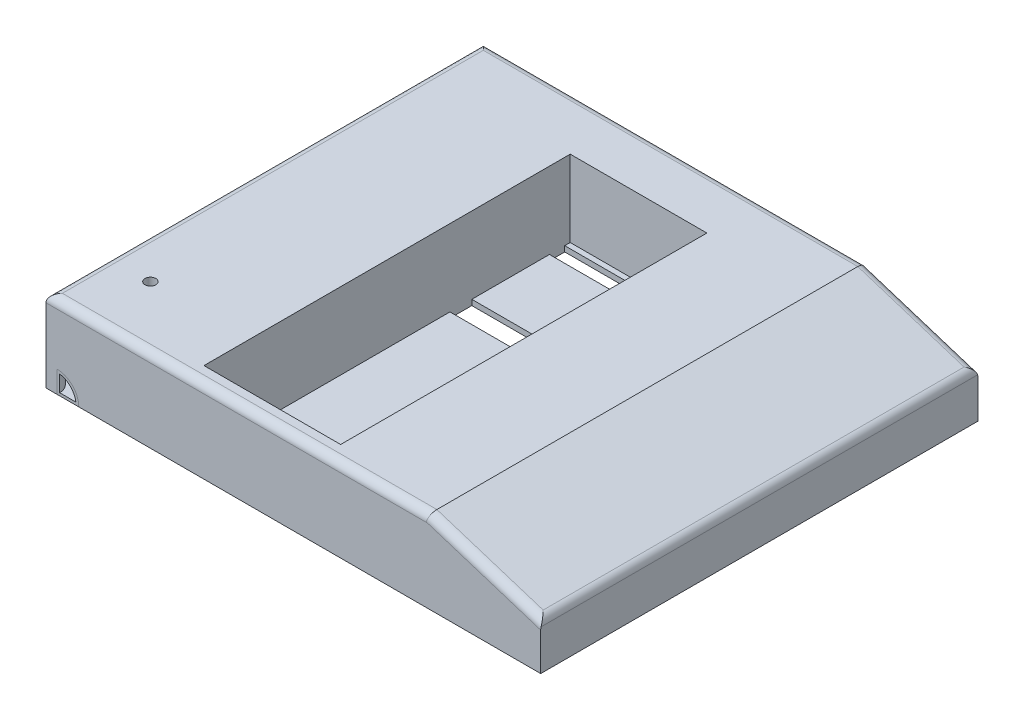
from build123d import *

# Parameters (mm, degrees)
SKETCH1_W            = 90.5
SKETCH1_H            = 80
BOSS_EXTRUDE1_DEPTH  = 15
SHELL3_T             = -1.5
CUT_EXTRUDE2_DEPTH   = 1.5
SKETCH6_W            = 13.15
SKETCH6_H            = 7.1
CUT_EXTRUDE3_DEPTH   = 1.5
SKETCH9_W            = 16.15
SKETCH9_H            = 1.55
BOSS_EXTRUDE2_DEPTH  = 1.5
FILLET7_R            = 1.5
SKETCH20_W           = 25
SKETCH20_H           = 67
BOSS_EXTRUDE8_DEPTH  = 14
SKETCH20_2_W         = 25
SKETCH20_2_H         = 67
CUT_EXTRUDE9_DEPTH   = 1.5
SHELL6_T             = 1
SKETCH21_W           = 1
SKETCH21_H           = 0.5
SKETCH21_H_2         = 7.5
BOSS_EXTRUDE9_DEPTH  = 13.5
SKETCH11_R           = 1
BOSS_EXTRUDE10_DEPTH = 10
SKETCH11_3_R         = 1
CUT_EXTRUDE10_DEPTH  = 1.5
SHELL9_T             = 1
CUT_REVOLVE4_ANGLE   = 90
REVOLVE3_ANGLE       = 90
SHELL14_T            = -0.5
SKETCH41_W           = 25
SKETCH41_H           = 2.8
SKETCH41_H_2         = 4
SKETCH41_H_3         = 2.4
CUT_EXTRUDE11_DEPTH  = 1
SKETCH45_W           = 21.507249936
SKETCH45_H           = 80
CUT_EXTRUDE13_DEPTH  = 10
SKETCH45_2_W         = 21.507249936
SKETCH45_2_H         = 80
BOSS_EXTRUDE11_DEPTH = 1.5
FILLET11_R           = 1.5


with BuildPart() as part:
    # Sketch1 → Boss-Extrude1 (new body)
    with BuildSketch(Plane(origin=(0, 0, 0), x_dir=(1, 0, 0), z_dir=(0, 1, 0))):
        Rectangle(SKETCH1_W, SKETCH1_H)
    extrude(amount=BOSS_EXTRUDE1_DEPTH)

    # Shell3
    shell3_openings = [part.faces().sort_by_distance(p)[0] for p in [
        (0, 0, 0),
    ]]
    offset(amount=SHELL3_T, openings=shell3_openings, kind=Kind.INTERSECTION)

    # Sketch4 → Cut-Extrude2 (cut)
    with BuildSketch(Plane.ZY.offset(45.25)):
        with BuildLine():
            Line((-34.3, 3.2), (-28.56, 3.2))
            ThreePointArc((-28.56, 3.2), (-26.96, 1.6), (-28.56, 0))
            Line((-28.56, 0), (-34.3, 0))
            ThreePointArc((-34.3, 0), (-35.9, 1.6), (-34.3, 3.2))
        make_face()
    extrude(amount=-CUT_EXTRUDE2_DEPTH, mode=Mode.SUBTRACT)

    # Sketch6 → Cut-Extrude3 (cut)
    with BuildSketch(Plane.ZY.offset(45.25)):
        with Locations((-17.575, 3.55)):
            Rectangle(SKETCH6_W, SKETCH6_H)
    extrude(amount=-CUT_EXTRUDE3_DEPTH, mode=Mode.SUBTRACT)

    # Sketch9 → Boss-Extrude2 (add)
    with BuildSketch(Plane.ZY.offset(45.25)):
        with Locations((-17.575, 0.775)):
            Rectangle(SKETCH9_W, SKETCH9_H)
    extrude(amount=BOSS_EXTRUDE2_DEPTH)

    # Fillet7
    fillet7_edges = [part.edges().sort_by_distance(p)[0] for p in [
        (-45.25, 15, 0),
        (0, 15, 40),
        (45.25, 15, 0),
        (0, 15, -40),
    ]]
    fillet(fillet7_edges, radius=FILLET7_R)

    # Sketch20 → Boss-Extrude8 (add)
    with BuildSketch(Plane(origin=(0, 15, 0), x_dir=(1, 0, 0), z_dir=(0, 1, 0))):
        with Locations((-6.85, -3.5)):
            Rectangle(SKETCH20_W, SKETCH20_H)
    extrude(amount=-BOSS_EXTRUDE8_DEPTH)

    # Sketch20<2> → Cut-Extrude9 (cut)
    with BuildSketch(Plane(origin=(0, 15, 0), x_dir=(1, 0, 0), z_dir=(0, 1, 0))):
        with Locations((-6.85, -3.5)):
            Rectangle(SKETCH20_2_W, SKETCH20_2_H)
    extrude(amount=-CUT_EXTRUDE9_DEPTH, mode=Mode.SUBTRACT)


with BuildPart() as cut_extrude9_piece_1:
    # of the separate pieces the step leaves, piece 1, a body of its own (cut_extrude9_pieces)
    add(part.part.solids().sort_by_distance((-19.35, 1, -30))[0])

    # Shell6
    shell6_openings = [cut_extrude9_piece_1.faces().sort_by_distance(p)[0] for p in [
        (-6.85, 13.5, 3.5),
    ]]
    offset(amount=SHELL6_T, openings=shell6_openings, kind=Kind.INTERSECTION)



with BuildPart() as cut_extrude9_piece_2:
    # of the separate pieces the step leaves, piece 2, a body of its own (cut_extrude9_pieces)
    add(part.part.solids().sort_by_distance((-45.25, 13.5, 40))[0])


with BuildPart() as cut_extrude9_piece_1_1:
    add(cut_extrude9_piece_1.part)

    add(cut_extrude9_piece_2.part)  # Boss-Extrude9 merges Cut-Extrude9 piece 2
    # Sketch21 → Boss-Extrude9 (add)
    with BuildSketch(Plane(origin=(0, 13.5, 0), x_dir=(-1, 0, 0), z_dir=(0, -1, 0))):
        with Locations((-6.15, -38.25)):
            Rectangle(SKETCH21_W, SKETCH21_H)
        with Locations((-6.15, 34.75)):
            Rectangle(SKETCH21_W, SKETCH21_H_2)
    extrude(amount=BOSS_EXTRUDE9_DEPTH)

    # Sketch11 → Boss-Extrude10 (add)
    with BuildSketch(Plane(origin=(0, 15, 0), x_dir=(1, 0, 0), z_dir=(0, 1, 0))):
        with Locations(Location((-37.55, -28.6, 0), (0, 0, 270))):
            Circle(SKETCH11_R)
    extrude(amount=-BOSS_EXTRUDE10_DEPTH)

    # Sketch11<3> → Cut-Extrude10 (cut)
    with BuildSketch(Plane(origin=(0, 15, 0), x_dir=(1, 0, 0), z_dir=(0, 1, 0))):
        with Locations(Location((-37.55, -28.6, 0), (0, 0, 270))):
            Circle(SKETCH11_3_R)
    extrude(amount=-CUT_EXTRUDE10_DEPTH, mode=Mode.SUBTRACT)


with BuildPart() as cut_extrude10_piece_1:
    # of the separate pieces the step leaves, piece 1, a body of its own (cut_extrude10_pieces)
    add(cut_extrude9_piece_1_1.part.solids().sort_by_distance((-45.25, 13.5, 40))[0])

    # Sketch33 → Cut-Revolve4 (revolve, cut)
    with BuildSketch(Plane.XY.offset(40)):
        with BuildLine():
            Line((-43.25, 4), (-43.25, 0))
            Line((-43.25, 0), (-39.25, 0))
            ThreePointArc((-39.25, 0), (-40.421572875, 2.828427125), (-43.25, 4))
        make_face()
    revolve(axis=Axis((-45.25, 15, 40), (0, 1, 0)), revolution_arc=CUT_REVOLVE4_ANGLE, mode=Mode.SUBTRACT)

    # Sketch41 → Cut-Extrude11 (cut)
    with BuildSketch(Plane(origin=(0, 1, 0), x_dir=(1, 0, 0), z_dir=(0, 1, 0))):
        with Locations((-6.85, 27.6)):
            Rectangle(SKETCH41_W, SKETCH41_H)
        with Locations((-6.85, 10)):
            Rectangle(SKETCH41_W, SKETCH41_H_2)
        with Locations((-6.85, -27.5)):
            Rectangle(SKETCH41_W, SKETCH41_H_3)
    extrude(amount=-CUT_EXTRUDE11_DEPTH, mode=Mode.SUBTRACT)

    # Sketch45 → Cut-Extrude13 (cut)
    with BuildSketch(Plane(origin=(6.62600572, 20.781563394, 0), x_dir=(-0.9527442677113392, 0.3037735346326008, 0), z_dir=(-0.3037735346326008, -0.9527442677113392, 0))):
        with Locations((-29.786103886, 0)):
            Rectangle(SKETCH45_W, SKETCH45_H)
    extrude(amount=-CUT_EXTRUDE13_DEPTH, mode=Mode.SUBTRACT)

    # Sketch45<2> → Boss-Extrude11 (add)
    with BuildSketch(Plane(origin=(6.62600572, 20.781563394, 0), x_dir=(-0.9527442677113392, 0.3037735346326008, 0), z_dir=(-0.3037735346326008, -0.9527442677113392, 0))):
        with Locations((-29.786103886, 0)):
            Rectangle(SKETCH45_2_W, SKETCH45_2_H)
    extrude(amount=BOSS_EXTRUDE11_DEPTH)

    # Fillet11
    fillet11_edges = [cut_extrude10_piece_1.edges().sort_by_distance(p)[0] for p in [
        (45.25, 8.466666667, 0),
        (35.004545455, 11.733333333, 40),
        (35.004545455, 11.733333333, -40),
    ]]
    fillet(fillet11_edges, radius=FILLET11_R - 0.0001)  # a hair under: the kernel refuses the full size


with BuildPart() as cut_extrude10_piece_2:
    # of the separate pieces the step leaves, piece 2, a body of its own (cut_extrude10_pieces)
    add(cut_extrude9_piece_1_1.part.solids().sort_by_distance((-37.55, 5, 29.6))[0])

    # Shell9
    shell9_openings = [cut_extrude10_piece_2.faces().sort_by_distance(p)[0] for p in [
        (-37.55, 5, 28.6),
        (-37.55, 13.5, 28.6),
    ]]
    offset(amount=SHELL9_T, openings=shell9_openings, kind=Kind.INTERSECTION)


with BuildPart() as body_3:
    # Sketch33<2> → Revolve3 (revolve)
    with BuildSketch(Plane.XY.offset(40)):
        with BuildLine():
            Line((-43.25, 4), (-43.25, 0))
            Line((-43.25, 0), (-39.25, 0))
            ThreePointArc((-39.25, 0), (-40.421572875, 2.828427125), (-43.25, 4))
        make_face()
    revolve(axis=Axis((-45.25, 15, 40), (0, 1, 0)), revolution_arc=REVOLVE3_ANGLE)

    # Shell14
    shell14_openings = [body_3.faces().sort_by_distance(p)[0] for p in [
        (-45.25, 1.697652726, 36.302347274),
        (-41.552347274, 1.697652726, 40),
    ]]
    offset(amount=SHELL14_T, openings=shell14_openings)


solid = Compound([cut_extrude10_piece_1.part, cut_extrude10_piece_2.part, body_3.part])
